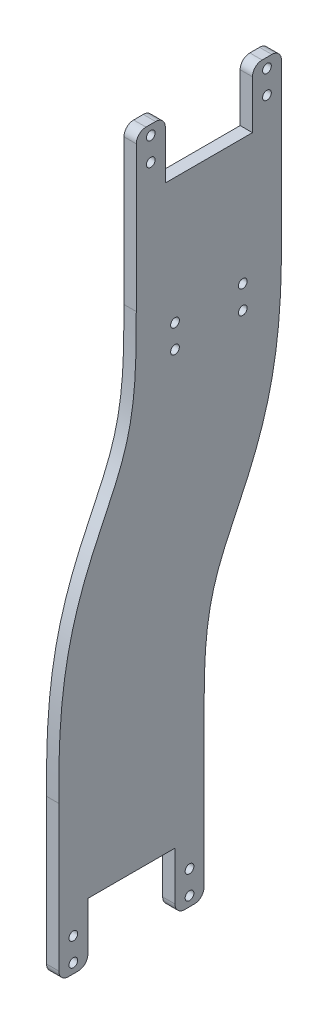
from build123d import *

# Parameters (mm, degrees)
SALIENTE_EXTRUIR1_DEPTH      = 6.35
TALADRO_DE_MARGEN_PARA_M41_D = 4.5
REDONDEO1_R                  = 5


# Read off the part's stored shape, not the designer's step: Saliente-Extruir1
with BuildPart() as part:
    # Saliente-Extruir1 outline → Saliente-Extruir1 (new body)
    with BuildSketch(Plane(origin=(0, 0, 0), x_dir=(0, 0, -1), z_dir=(1, 0, 0))):
        with BuildLine():
            Line((-2.5, 180), (-17.5, 180))
            Line((-17.5, 180), (-17.5, 100))
            add(Edge.make_bspline(
                [(-17.5, 100), (-17.5, 98.712751966), (-17.500047788, 96.116321069), (-17.51148981, 91.098940131), (-17.565479393, 85.046877218), (-17.737925717, 78.203948852), (-18.147729277, 69.656133307), (-19.038911227, 60.095322328), (-20.718334539, 50.310614009), (-22.956153632, 41.771686415), (-25.785586207, 33.773608765), (-29.338865081, 25.548124026), (-33.697565336, 16.449967912), (-38.713561507, 6.016494532), (-43.953609584, -6.016361906), (-48.809754323, -19.661313126), (-52.733015331, -34.671033487), (-55.439087369, -50.654463146), (-56.694005293, -64.452671708), (-57.222054598, -75.565918854), (-57.428472519, -83.87427142), (-57.487938926, -90.701655992), (-57.499988878, -96.070691027), (-57.5, -98.684323127), (-57.5, -100)],
                knots=[0, 0, 0, 0, 0.015625, 0.03125, 0.0625, 0.09375, 0.125, 0.1875, 0.25, 0.3125, 0.375, 0.4375, 0.5, 0.5625, 0.625, 0.6875, 0.75, 0.8125, 0.875, 0.90625, 0.9375, 0.96875, 0.984375, 1, 1, 1, 1], degree=3))
            Line((-57.5, -100), (-57.5, -180))
            Line((-57.5, -180), (-42.5, -180))
            Line((-42.5, -180), (-42.5, -150))
            Line((-42.5, -150), (2.5, -150))
            Line((2.5, -150), (2.5, -180))
            Line((2.5, -180), (17.5, -180))
            Line((17.5, -180), (17.5, -100))
            add(Edge.make_bspline(
                [(17.5, -100), (17.5, -98.712751966), (17.500047788, -96.116321069), (17.51148981, -91.098940131), (17.565479393, -85.046877218), (17.737925717, -78.203948852), (18.147729277, -69.656133307), (19.038911227, -60.095322328), (20.718334539, -50.310614009), (22.956153632, -41.771686415), (25.785586207, -33.773608765), (29.338865081, -25.548124026), (33.697565336, -16.449967912), (38.713561507, -6.016494532), (43.953609584, 6.016361906), (48.809754323, 19.661313126), (52.733015331, 34.671033487), (55.439087369, 50.654463146), (56.694005293, 64.452671708), (57.222054598, 75.565918854), (57.428472519, 83.87427142), (57.487938926, 90.701655992), (57.499988878, 96.070691027), (57.5, 98.684323127), (57.5, 100)],
                knots=[0, 0, 0, 0, 0.015625, 0.03125, 0.0625, 0.09375, 0.125, 0.1875, 0.25, 0.3125, 0.375, 0.4375, 0.5, 0.5625, 0.625, 0.6875, 0.75, 0.8125, 0.875, 0.90625, 0.9375, 0.96875, 0.984375, 1, 1, 1, 1], degree=3))
            Line((57.5, 100), (57.5, 180))
            Line((57.5, 180), (42.5, 180))
            Line((42.5, 180), (42.5, 150))
            Line((42.5, 150), (-2.5, 150))
            Line((-2.5, 150), (-2.5, 180))
        make_face()
    extrude(amount=SALIENTE_EXTRUIR1_DEPTH)

    # Taladro de margen para M41 (through all)
    with Locations(Plane.ZY):
        with Locations((10, 163), (10, 175), (-50, 163), (-50, 175), (50, -175), (50, -163), (-10, -175), (-10, -163), (-2.5, 85), (-2.5, 73), (-37.5, 73), (-37.5, 85)):
            Hole(TALADRO_DE_MARGEN_PARA_M41_D / 2)

    # Redondeo1
    redondeo1_edges = [part.edges().sort_by_distance(p)[0] for p in [
        (3.175, 180, 2.5),
        (3.175, 180, -42.5),
        (3.175, 180, -57.5),
        (3.175, -180, -17.5),
        (3.175, -180, -2.5),
        (3.175, -180, 42.5),
        (3.175, -180, 57.5),
        (3.175, 180, 17.5),
    ]]
    fillet(redondeo1_edges, radius=REDONDEO1_R)


solid = part.part
